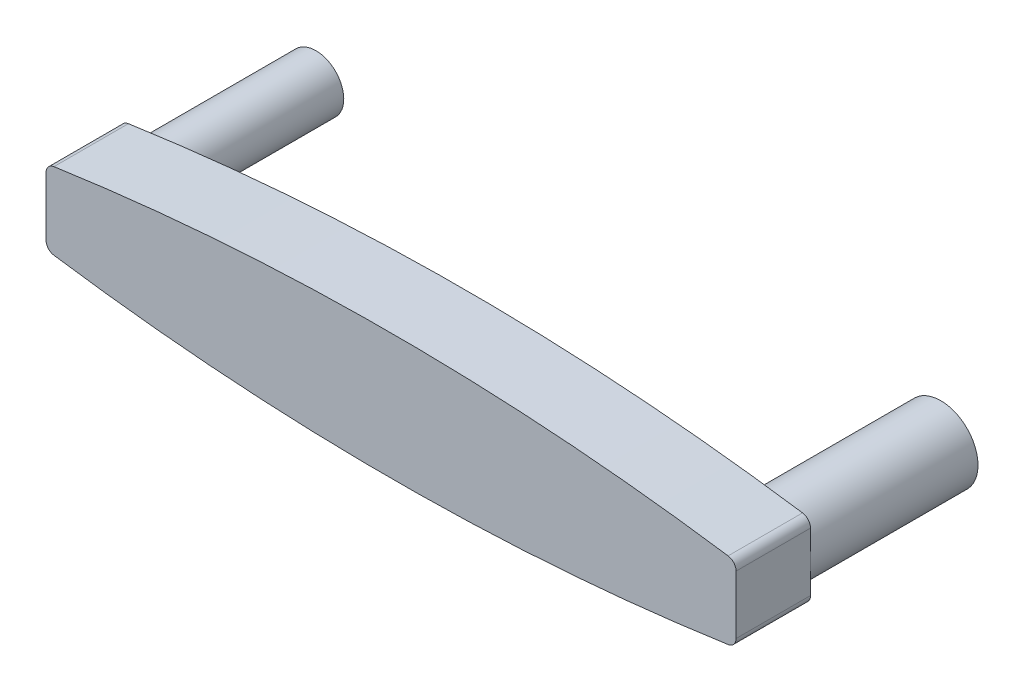
from build123d import *

# Parameters (mm, degrees)
BOSS_EXTRUDE1_DEPTH = 4
SKETCH1_3_R         = 1.5
SKETCH1_3_R_2       = 2
BOSS_EXTRUDE2_DEPTH = 9
FILLET1_R           = 0.5


with BuildPart() as part:
    # Sketch1 → Boss-Extrude1 (new body)
    with BuildSketch(Plane.XY):
        with BuildLine():
            Line((0, 0), (0, -4))
            ThreePointArc((0, -4), (18.54, -5.382572426), (37.08, -4))
            Line((37.08, -4), (37.08, 0))
            ThreePointArc((37.08, 0), (18.54, 1.382572426), (0, 0))
        make_face()
    extrude(amount=BOSS_EXTRUDE1_DEPTH)

    # Sketch1<3> → Boss-Extrude2 (add)
    with BuildSketch(Plane.XY):
        with Locations((1.5, -2)):
            Circle(SKETCH1_3_R)
        with Locations((35.08, -2)):
            Circle(SKETCH1_3_R_2)
    extrude(amount=-BOSS_EXTRUDE2_DEPTH)

    # Fillet1
    fillet1_edges = [part.edges().sort_by_distance(p)[0] for p in [
        (37.08, -4, 2),
        (37.08, 0, 2),
        (0, -4, 2),
        (0, 0, 2),
    ]]
    fillet(fillet1_edges, radius=FILLET1_R)


solid = part.part
